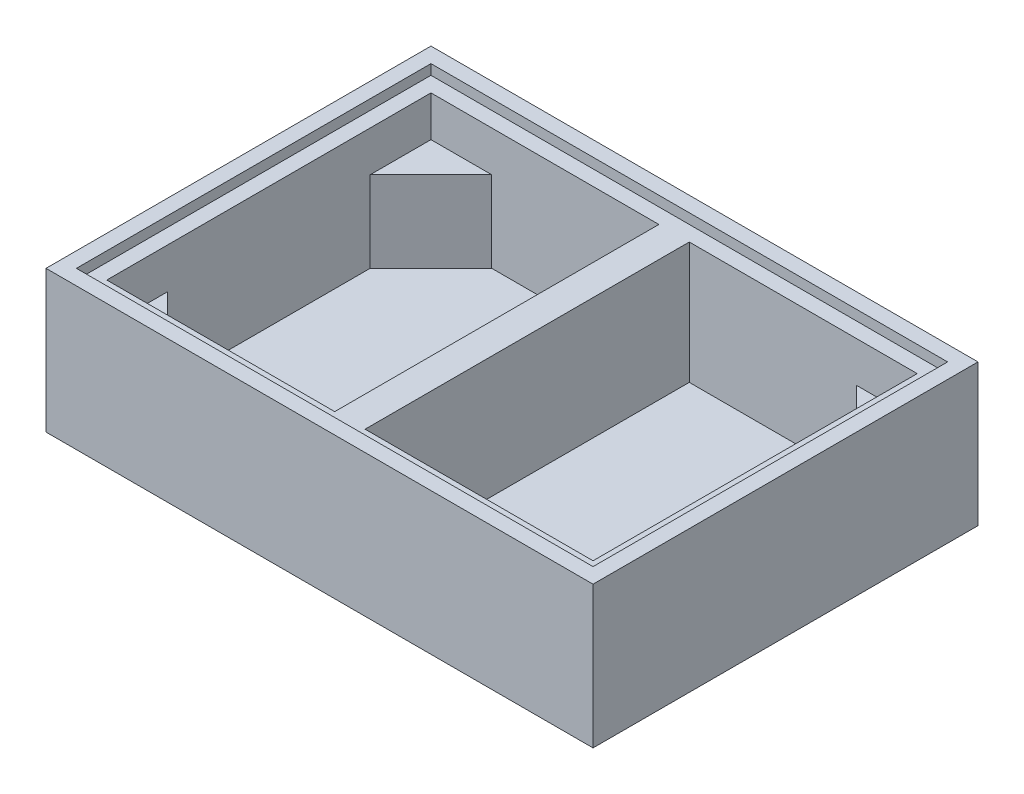
from build123d import *

# Parameters (mm, degrees)
SKETCH1_W           = 540
SKETCH1_H           = 380
BOSS_EXTRUDE1_DEPTH = 140
SKETCH3_W           = 510
SKETCH3_H           = 350
CUT_EXTRUDE1_DEPTH  = 10
SKETCH2_W           = 225
SKETCH2_H           = 320
CUT_EXTRUDE2_DEPTH  = 40
CUT_EXTRUDE3_DEPTH  = 80


with BuildPart() as part:
    # Sketch1 → Boss-Extrude1 (new body)
    with BuildSketch(Plane(origin=(0, 0, 0), x_dir=(1, 0, 0), z_dir=(0, 1, 0))):
        with Locations((270, 190)):
            Rectangle(SKETCH1_W, SKETCH1_H)
    extrude(amount=-BOSS_EXTRUDE1_DEPTH)

    # Sketch3 → Cut-Extrude1 (cut)
    with BuildSketch(Plane(origin=(0, 0, 0), x_dir=(1, 0, 0), z_dir=(0, 1, 0))):
        with Locations((270, 190)):
            Rectangle(SKETCH3_W, SKETCH3_H)
    extrude(amount=-CUT_EXTRUDE1_DEPTH, mode=Mode.SUBTRACT)

    # Sketch2 → Cut-Extrude2 (cut)
    with BuildSketch(Plane(origin=(0, -10, 0), x_dir=(1, 0, 0), z_dir=(0, 1, 0))):
        with Locations((142.5, 190)):
            Rectangle(SKETCH2_W, SKETCH2_H)
        with Locations((397.5, 190)):
            Rectangle(SKETCH2_W, SKETCH2_H)
    extrude(amount=-CUT_EXTRUDE2_DEPTH, mode=Mode.SUBTRACT)

    # Sketch5 → Cut-Extrude3 (cut)
    with BuildSketch(Plane(origin=(0, -50, 0), x_dir=(1, 0, 0), z_dir=(0, 1, 0))):
        Polygon((30, 290), (90, 350), (255, 350), (255, 30), (90, 30), (30, 90), align=None)
        Polygon((510, 90), (450, 30), (285, 30), (285, 350), (450, 350), (510, 290), align=None)
    extrude(amount=-CUT_EXTRUDE3_DEPTH, mode=Mode.SUBTRACT)


solid = part.part
